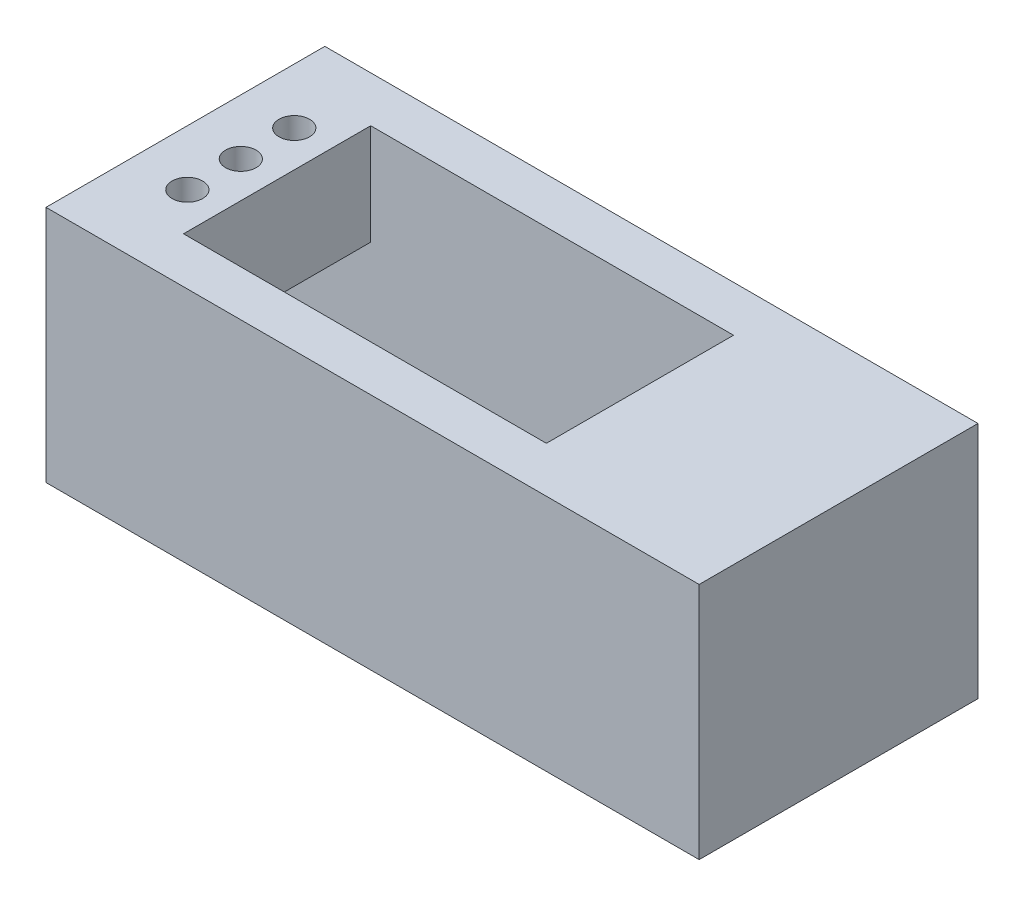
from build123d import *

# Parameters (mm, degrees)
SKETCH1_W           = 23.75
SKETCH1_H           = 12.25
BOSS_EXTRUDE1_DEPTH = 15.6
SKETCH2_W           = 12.25
SKETCH2_H           = 9
CUT_EXTRUDE1_DEPTH  = 10
SKETCH3_R           = 1
CUT_EXTRUDE2_DEPTH  = 3


with BuildPart() as part:
    # Sketch1 → Boss-Extrude1 (new body)
    with BuildSketch(Plane(origin=(0, 0, 0), x_dir=(1, 0, 0), z_dir=(0, 1, 0))):
        Polygon((17.875, -9.125), (24.875, -9.125), (24.875, 9.125), (17.875, 9.125), (-17.875, 9.125), (-17.875, -9.125), align=None)
        Rectangle(SKETCH1_W, SKETCH1_H, mode=Mode.SUBTRACT)
    extrude(amount=BOSS_EXTRUDE1_DEPTH)

    # Sketch2 → Cut-Extrude1 (cut)
    with BuildSketch(Plane.ZY.offset(17.875)):
        with Locations((0, 4.5)):
            Rectangle(SKETCH2_W, SKETCH2_H)
    extrude(amount=-CUT_EXTRUDE1_DEPTH, mode=Mode.SUBTRACT)

    # Sketch3 → Cut-Extrude2 (cut)
    with BuildSketch(Plane(origin=(0, 15.6, 0), x_dir=(1, 0, 0), z_dir=(0, 1, 0))):
        with Locations((-14.245, 3.495)):
            Circle(SKETCH3_R)
        with Locations((-14.245, -0.005)):
            Circle(SKETCH3_R)
        with Locations((-14.245, -3.505)):
            Circle(SKETCH3_R)
    extrude(amount=-CUT_EXTRUDE2_DEPTH, mode=Mode.SUBTRACT)


solid = part.part
